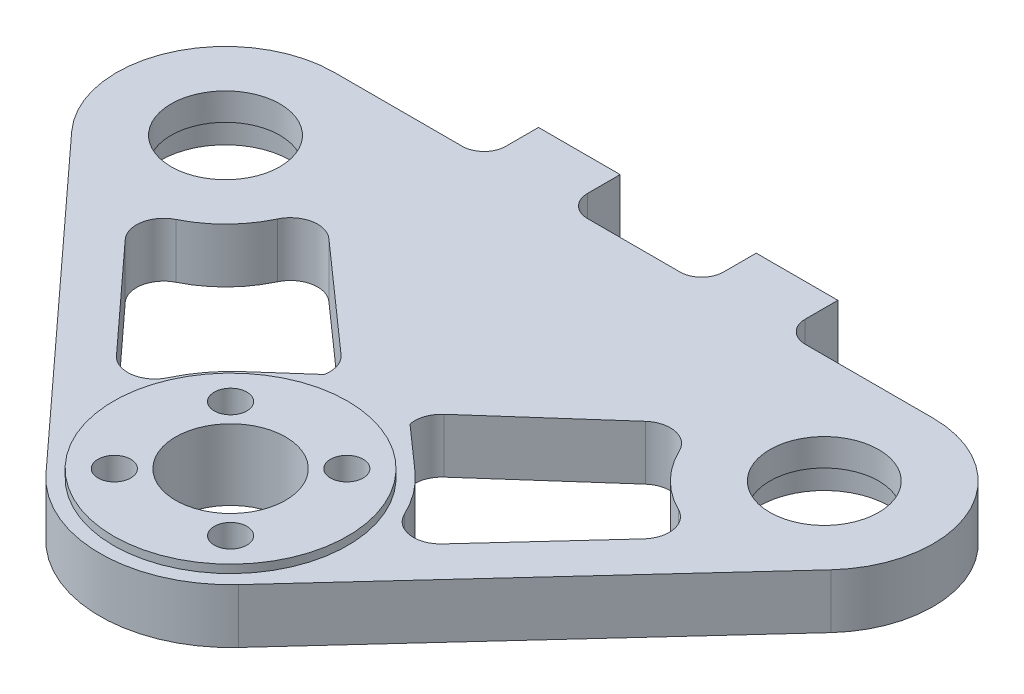
from build123d import *

# Parameters (mm, degrees)
SKETCH1_R                   = 10.1
SKETCH1_R_2                 = 10
MAIN_BODY_DEPTH             = 10
SKETCH2_R                   = 12
BEARING_RECESS_DEPTH        = 5
STANDOFF_SECTION_DEPTH      = 1.5
STANDOFF_SECTION_DEPTH_BACK = 11.5
SKETCH3_R                   = 21.5
SKETCH3_R_2                 = 10.1
EXTRA_GEOMETRY_DEPTH        = 10
SKETCH8_R                   = 2
CUT_EXTRUDE1_DEPTH          = 6
SKETCH4_R                   = 3
M6_BOLT_HOLES_DEPTH         = 114.407669812


with BuildPart() as part:
    # Sketch1 → Main Body (new body)
    with BuildSketch(Plane(origin=(0, 0, 0), x_dir=(1, 0, 0), z_dir=(0, 1, 0))):
        with BuildLine():
            Line((-69.741518057, 40.551033083), (-17.689821668, -16.219439242))
            ThreePointArc((-17.689821668, -16.219439242), (17.115072934, -16.824811395), (15.914514265, 17.96463848))
            Line((15.914514265, 17.96463848), (-41.737904779, 69.037764518))
            ThreePointArc((-41.737904779, 69.037764518), (-69.262560778, 68.087908614), (-69.741518057, 40.551033083))
        make_face()
        Circle(SKETCH1_R, mode=Mode.SUBTRACT)
        with Locations((-55, 54.067232452)):
            Circle(SKETCH1_R_2, mode=Mode.SUBTRACT)
        with BuildLine():
            Line((-47.625471592, 28.267691162), (-29.927098797, 8.964862385))
            ThreePointArc((-29.927098797, 8.964862385), (-25.488644513, 7.400949716), (-21.717284924, 10.215651499))
            ThreePointArc((-21.717284924, 10.215651499), (-17.115072934, 16.824811395), (-10.585592312, 21.539388))
            ThreePointArc((-10.585592312, 21.539388), (-7.835804554, 25.358336357), (-9.475400239, 29.769393516))
            Line((-9.475400239, 29.769393516), (-29.078104388, 47.135037426))
            ThreePointArc((-29.078104388, 47.135037426), (-33.398420323, 48.290403264), (-36.914902554, 45.527370018))
            ThreePointArc((-36.914902554, 45.527370018), (-40.737439222, 40.046556289), (-46.152073662, 36.130839294))
            ThreePointArc((-46.152073662, 36.130839294), (-48.85455966, 32.56761471), (-47.625471592, 28.267691162))
        make_face(mode=Mode.SUBTRACT)
    extrude(amount=MAIN_BODY_DEPTH)

    # Sketch2 → Bearing Recess (cut)
    with BuildSketch(Plane.XZ):
        with Locations((-55, -54.067232452)):
            Circle(SKETCH2_R)
    extrude(amount=-BEARING_RECESS_DEPTH, mode=Mode.SUBTRACT)

    # Sketch3 → Standoff Section (add, two sides: drawn at the far end of the back side and taken through both)
    with BuildSketch(Plane.XZ.offset(-STANDOFF_SECTION_DEPTH_BACK)):
        Circle(SKETCH3_R)
        Circle(SKETCH3_R_2, mode=Mode.SUBTRACT)
    extrude(amount=STANDOFF_SECTION_DEPTH + STANDOFF_SECTION_DEPTH_BACK)

    # Sketch6 → Extra Geometry (add)
    with BuildSketch(Plane(origin=(0, 0, 0), x_dir=(1, 0, 0), z_dir=(0, 1, 0))):
        with BuildLine():
            Line((0, 74.067232452), (0, 32.062988668))
            Line((0, 32.062988668), (-41.737904779, 69.037764518))
            ThreePointArc((-41.737904779, 69.037764518), (-47.908125823, 72.767642091), (-55, 74.067232452))
            Line((-55, 74.067232452), (-31.5, 74.067232452))
            ThreePointArc((-31.5, 74.067232452), (-28.671572875, 75.238805327), (-27.5, 78.067232452))
            Line((-27.5, 78.067232452), (-27.5, 84.067232452))
            Line((-27.5, 84.067232452), (-12.5, 84.067232452))
            Line((-12.5, 84.067232452), (-12.5, 78.067232452))
            ThreePointArc((-12.5, 78.067232452), (-11.328427125, 75.238805327), (-8.5, 74.067232452))
            Line((-8.5, 74.067232452), (0, 74.067232452))
        make_face()
    extrude(amount=EXTRA_GEOMETRY_DEPTH)

    # Sketch8 → Cut-Extrude1 (cut)
    with BuildSketch(Plane(origin=(0, 0, -84.067232452), x_dir=(-1, 0, 0), z_dir=(0, 0, -1))):
        with Locations((20, 5)):
            Circle(SKETCH8_R)
    extrude(amount=-CUT_EXTRUDE1_DEPTH, mode=Mode.SUBTRACT)

    # Mirror2: part across plane


with BuildPart() as part_1:
    add(part.part)
    add(part.part.mirror(Plane(origin=(0, 0, 0), x_dir=(0, 0, 1), z_dir=(1, 0, 0))))

    # Sketch4 → M6 Bolt holes (cut, through all)
    with BuildSketch(Plane.XZ.offset(1.5)):
        with Locations((-10.677312396, 10.677312396)):
            Circle(SKETCH4_R)
        with Locations((10.677312396, 10.677312396)):
            Circle(SKETCH4_R)
        with Locations((10.677312396, -10.677312396)):
            Circle(SKETCH4_R)
        with Locations((-10.677312396, -10.677312396)):
            Circle(SKETCH4_R)
    extrude(amount=-M6_BOLT_HOLES_DEPTH, mode=Mode.SUBTRACT)


solid = part_1.part
